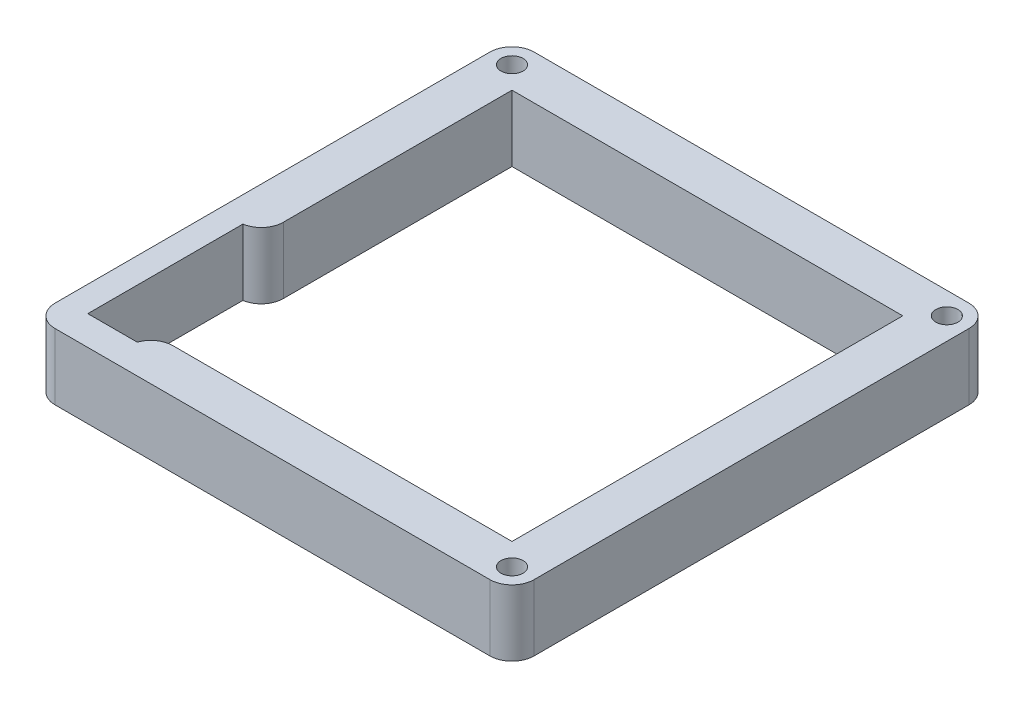
from build123d import *

# Parameters (mm, degrees)
SKETCH1_W           = 137.961167182
SKETCH1_H           = 137.961167182
SKETCH1_R           = 3.175
BOSS_EXTRUDE1_DEPTH = 19.05
FILLET1_R           = 6.35
FILLET2_R           = 6.35


with BuildPart() as part:
    # Sketch1 → Boss-Extrude1 (new body)
    with BuildSketch(Plane(origin=(0, 0, 0), x_dir=(1, 0, 0), z_dir=(0, 1, 0))):
        Rectangle(SKETCH1_W, SKETCH1_H)
        Polygon((-61.63707698, -60.545979349), (-61.63707698, -15.874596852), (-56.280583591, -15.874596852), (-56.280583591, 56.280583591), (56.280583591, 56.280583591), (56.280583591, -56.280583591), (-47.38767698, -56.280583591), (-47.38767698, -60.545979349), align=None, mode=Mode.SUBTRACT)
        with Locations(Location((62.630583591, -62.630583591, 0), (0, 0, 90))):
            Circle(SKETCH1_R, mode=Mode.SUBTRACT)
        with Locations(Location((-62.630583591, 62.630583591, 0), (0, 0, 90))):
            Circle(SKETCH1_R, mode=Mode.SUBTRACT)
        with Locations(Location((62.630583591, 62.630583591, 0), (0, 0, 90))):
            Circle(SKETCH1_R, mode=Mode.SUBTRACT)
    extrude(amount=BOSS_EXTRUDE1_DEPTH)

    # Fillet1
    fillet1_edges = [part.edges().sort_by_distance(p)[0] for p in [
        (68.980583591, 9.525, -68.980583591),
        (68.980583591, 9.525, 68.980583591),
        (-68.980583591, 9.525, 68.980583591),
        (-68.980583591, 9.525, -68.980583591),
    ]]
    fillet(fillet1_edges, radius=FILLET1_R)

    # Fillet2
    # the kernel refuses this fillet: 6.35 mm, written as the material it takes off along each edge
    with BuildSketch(Plane(origin=(-56.280583591, -15.679493896, 15.874596852), x_dir=(-1, 0, 0), z_dir=(0, 1, 0))) as fillet2_piece_1:
        with BuildLine():
            CenterArc((6.35, -6.271797558), FILLET2_R, 99.001349837, 80.998650163)
            Line((0, -6.271797558), (-0.127, -6.271797558))
            Line((-0.127, -6.271797558), (-0.127, 0))
            Line((-0.127, 0), (0, 0.127))
            ThreePointArc((0, 0.127), (2.678246694, 0.127), (5.336623257, 0.125435951))
            Line((5.336623257, 0.125435951), (5.356493389, 0))
        make_face()
    extrude(amount=50.408987792, mode=Mode.SUBTRACT)
    with BuildSketch(Plane(origin=(-47.38767698, -14.99519197, 56.280583591), x_dir=(1, 0, 0), z_dir=(0, 1, 0))) as fillet2_piece_2:
        with BuildLine():
            CenterArc((5.998076788, -6.35), FILLET2_R, 90, 70.835337627)
            Line((0, -4.265395758), (-0.119961536, -4.223703673))
            ThreePointArc((-0.119961536, -4.223703673), (-0.127, -2.132697879), (-0.127, 0))
            Line((-0.127, 0), (0, 0.127))
            Line((0, 0.127), (5.998076788, 0.127))
            Line((5.998076788, 0.127), (5.998076788, 0))
        make_face()
    extrude(amount=49.04038394, mode=Mode.SUBTRACT)


solid = part.part
